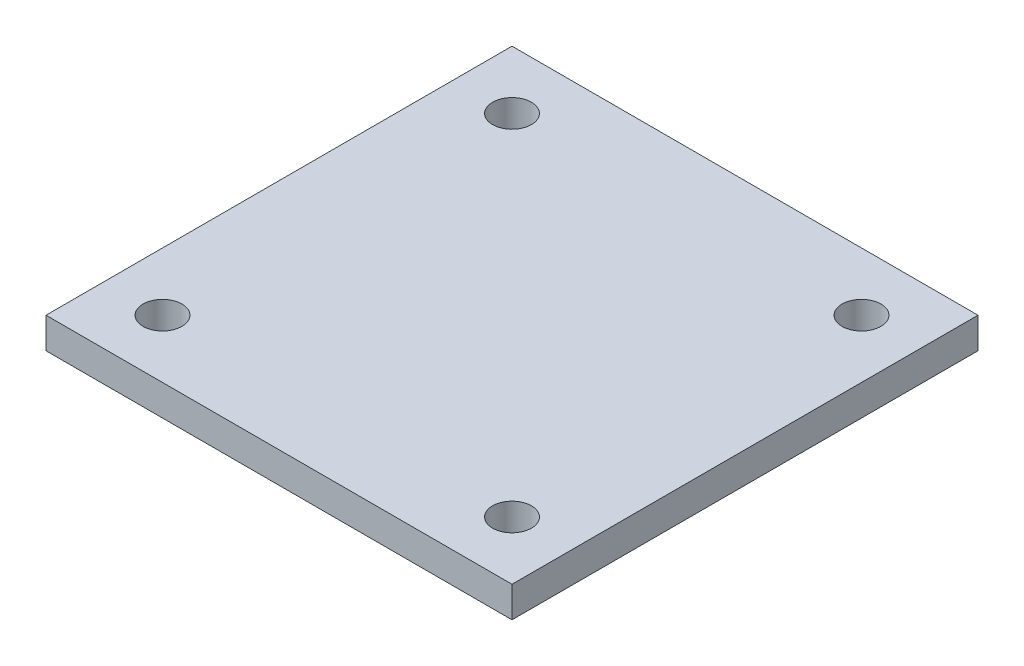
from build123d import *

# Parameters (mm, degrees)
ESQUISSE1_W        = 24
ESQUISSE1_H        = 24
ESQUISSE1_R        = 1
BOSS_EXTRU_1_DEPTH = 1.5875


with BuildPart() as part:
    # Esquisse1 → Boss.-Extru.1 (new body)
    with BuildSketch(Plane(origin=(0, 0, 0), x_dir=(1, 0, 0), z_dir=(0, 1, 0))):
        Rectangle(ESQUISSE1_W, ESQUISSE1_H)
        with Locations((-9, 9)):
            Circle(ESQUISSE1_R, mode=Mode.SUBTRACT)
        with Locations((9, 9)):
            Circle(ESQUISSE1_R, mode=Mode.SUBTRACT)
        with Locations((-9, -9)):
            Circle(ESQUISSE1_R, mode=Mode.SUBTRACT)
        with Locations((9, -9)):
            Circle(ESQUISSE1_R, mode=Mode.SUBTRACT)
    extrude(amount=BOSS_EXTRU_1_DEPTH)


solid = part.part
